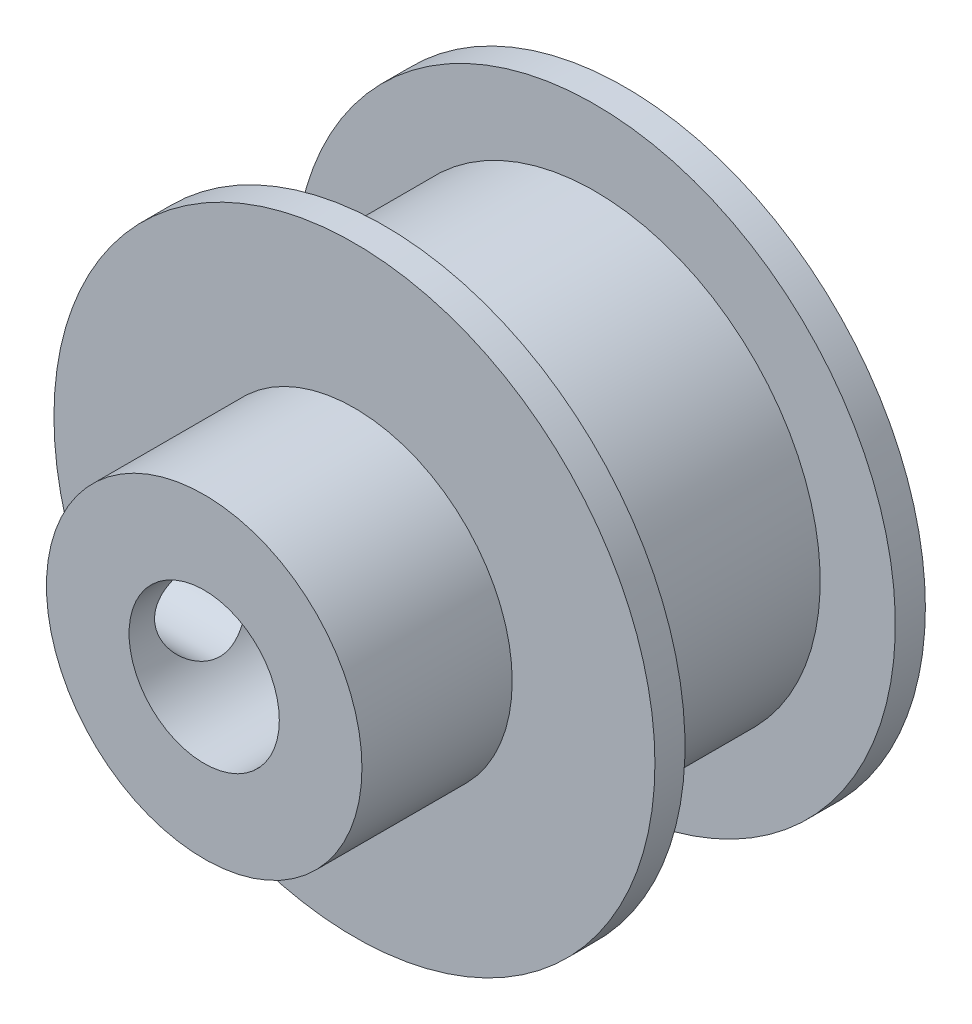
from build123d import *

# Parameters (mm, degrees)
ESQUISSE1_R             = 10
BOSS_EXTRU_1_DEPTH      = 9
ESQUISSE2_R             = 5.25
BOSS_EXTRU_2_DEPTH      = 5
ESQUISSE3_R             = 2.5
ENL_V_MAT_EXTRU_1_DEPTH = 20.899748742
ESQUISSE4_W             = 7
ESQUISSE4_H             = 2.5


# Read off the part's stored shape, not the designer's step: Dégagement M31
with BuildPart() as part:
    # Esquisse1 → Boss.-Extru.1 (new body)
    with BuildSketch(Plane.XY):
        Circle(ESQUISSE1_R)
    extrude(amount=BOSS_EXTRU_1_DEPTH)

    # Esquisse2 → Boss.-Extru.2 (add)
    with BuildSketch(Plane.XY.offset(9)):
        Circle(ESQUISSE2_R)
    extrude(amount=BOSS_EXTRU_2_DEPTH)

    # Esquisse3 → Enlèv. mat.-Extru.1 (cut, through all)
    with BuildSketch(Plane.XY.offset(14)):
        Circle(ESQUISSE3_R)
    extrude(amount=-ENL_V_MAT_EXTRU_1_DEPTH, mode=Mode.SUBTRACT)

    # Esquisse4 → Enlèvement de matière-Révolution1 (revolve, cut)
    with BuildSketch(Plane(origin=(0, 0, 0), x_dir=(0, 0, -1), z_dir=(1, 0, 0)), mode=Mode.PRIVATE) as enl_vement_de_mati_re_r_volution1_sk:
        with Locations((-4.5, 8.75)):
            Rectangle(ESQUISSE4_W, ESQUISSE4_H)
    revolve(enl_vement_de_mati_re_r_volution1_sk.sketch.rotate(Axis((0, 0, 0), (0, 0, 1)), 90), axis=Axis((0, 0, 0), (0, 0, 1)), mode=Mode.SUBTRACT)

    # Dégagement M31 outline → Dégagement M31 (revolve, cut)
    with BuildSketch(Plane.YX.offset(-11.551623765)):
        Polygon((1.6, -5.250016412), (1.6, -5.225), (1.6, -1.920645137), (0, -1.920645137), (0, -5.250016412), align=None)
        Polygon((1.625016412, -5.250016412), (1.599998144, -5.224998144), (1.6, -5.250016412), align=None)
    revolve(axis=Axis((0, 0, 11.551623765), (1, 0, 0)), mode=Mode.SUBTRACT)


solid = part.part
